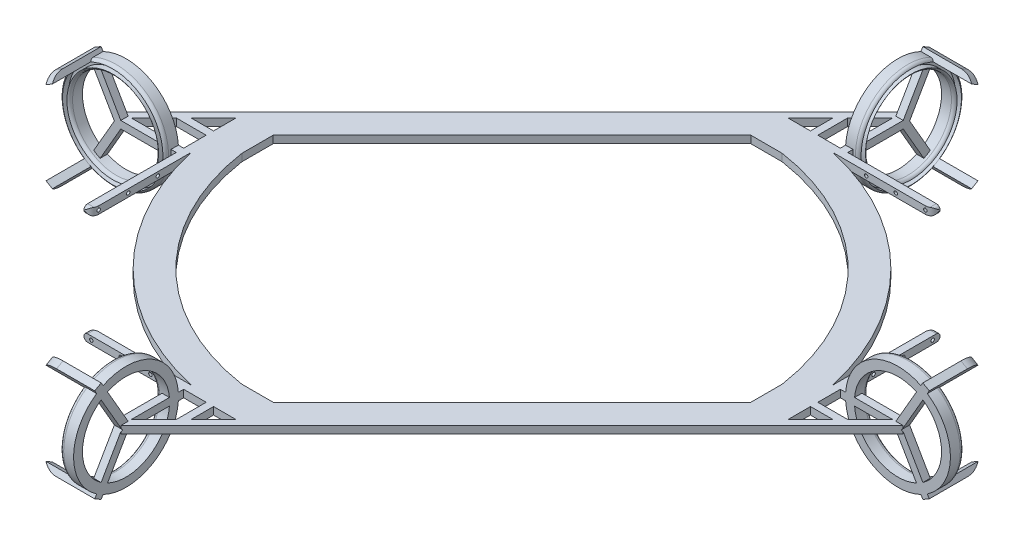
from build123d import *

# Parameters (mm, degrees)
SKETCH12_R                = 1.15
BOSS_EXTRUDE17_DEPTH      = 5
FILLET8_START             = -1
FILLET8_DEPTH             = 6
FILLET8_START_2           = -3
FILLET8_2_DEPTH           = 6
SKETCH13_W                = 12.5
SKETCH13_H                = 5
BOSS_EXTRUDE18_DEPTH      = 5
BOSS_EXTRUDE19_DEPTH      = 5
BOSS_EXTRUDE19_DEPTH_BACK = 5
SKETCH14_W                = 5
SKETCH14_H                = 5
FILLET9_R                 = 2.5
SKETCH21_R                = 35.5
SKETCH21_R_2              = 34
SKETCH21_R_3              = 31
SKETCH21_R_4              = 29.5
BOSS_EXTRUDE23_DEPTH      = 9
SKETCH22_R                = 34
SKETCH22_R_2              = 31
BOSS_EXTRUDE24_DEPTH      = 5
BOSS_EXTRUDE25_DEPTH      = 5
CIRPATTERN2_COUNT         = 3
SKETCH24_R                = 2.5
BOSS_EXTRUDE26_DEPTH      = 5
BOSS_EXTRUDE27_DEPTH      = 2.5
BOSS_EXTRUDE27_DEPTH_BACK = 2.5
CUT_EXTRUDE1_DEPTH        = 2.5
FILLET10_R                = 2.5
FILLET11_R                = 2.5
CIRPATTERN3_START         = -42.5
CIRPATTERN3_DEPTH         = 25.83484851
CIRPATTERN3_START_2       = 31.274990748
CIRPATTERN3_2_DEPTH       = 4.999999999
CIRPATTERN3_START_3       = -36.274990748
CIRPATTERN3_3_DEPTH       = 5
BOSS_EXTRUDE29_DEPTH      = 2.5
BOSS_EXTRUDE29_DEPTH_BACK = 2.5
CUT_EXTRUDE4_DEPTH        = 2.5
CUT_EXTRUDE4_DEPTH_BACK   = 2.5
BOSS_EXTRUDE32_DEPTH      = 2.5
BOSS_EXTRUDE32_DEPTH_BACK = 2.5
CHAMFER2_SIZE             = 15
CUT_EXTRUDE7_DEPTH        = 2.5
CUT_EXTRUDE7_DEPTH_BACK   = 2.5


with BuildPart() as part:
    # Sketch12 → Boss-Extrude17 (new body)
    with BuildSketch(Plane.XY):
        Polygon((-22.5, 2.5), (25, 2.5), (25, -2.5), (-22.5, -2.5), (-25, -2.5), (-25, 2.5), align=None)
        Circle(SKETCH12_R, mode=Mode.SUBTRACT)
        with Locations((-20, 0)):
            Circle(SKETCH12_R, mode=Mode.SUBTRACT)
        with Locations(Location((20, 0, 0), (0, 0, 180))):
            Circle(SKETCH12_R, mode=Mode.SUBTRACT)
    extrude(amount=BOSS_EXTRUDE17_DEPTH)

    # Fillet8: read off the stored shape, not the designer's step
    # Fillet8 outline → Fillet8 (cut)
    with BuildSketch(Plane.XY.offset(FILLET8_START)):
        with BuildLine():
            Line((25, 2.5), (22.5, 2.5))
            ThreePointArc((22.5, 2.5), (24.267766953, 1.767766953), (25, 0))
            Line((25, 0), (25, 2.5))
        make_face()
        with BuildLine():
            Line((25, -2.5), (25, 0))
            ThreePointArc((25, 0), (24.267766953, -1.767766953), (22.5, -2.5))
            Line((22.5, -2.5), (25, -2.5))
        make_face()
    extrude(amount=FILLET8_DEPTH, mode=Mode.SUBTRACT)

    # Fillet8 2 outline → Fillet8 2 (cut)
    with BuildSketch(Plane(origin=(0, 0, 0), x_dir=(1, 0, 0), z_dir=(0, 1, 0)).offset(FILLET8_START_2)):
        with BuildLine():
            Line((25, 2), (25, 0))
            ThreePointArc((25, 0), (23.535533906, -3.535533906), (20, -5))
            Line((20, -5), (27, -5))
            Line((27, -5), (27, 2))
            Line((27, 2), (25, 2))
        make_face()
    extrude(amount=FILLET8_2_DEPTH, mode=Mode.SUBTRACT)

    # Sketch13 → Boss-Extrude18 (add)
    with BuildSketch(Plane.XY):
        with Locations((-31.25, 0)):
            Rectangle(SKETCH13_W, SKETCH13_H)
    extrude(amount=BOSS_EXTRUDE18_DEPTH)

    # Sketch14 → Boss-Extrude19 (add, two sides: drawn at the far end of the back side and taken through both)
    with BuildSketch(Plane.XY.offset(-BOSS_EXTRUDE19_DEPTH_BACK)):
        with Locations((-40, 0)):
            Rectangle(SKETCH14_W, SKETCH14_H)
    extrude(amount=BOSS_EXTRUDE19_DEPTH + BOSS_EXTRUDE19_DEPTH_BACK)

    # Fillet9
    fillet9_edges = [part.edges().sort_by_distance(p)[0] for p in [
        (-42.5, 0, 5),
    ]]
    fillet(fillet9_edges, radius=FILLET9_R)

    # Sketch21 → Boss-Extrude23 (add)
    # profile 1 of 2: a face of its own
    with BuildSketch(Plane(origin=(-42.5, 0, 0), x_dir=(0, 0, -1), z_dir=(1, 0, 0))):
        with Locations(Location((39, 0, 0), (0, 0, 175.961743404))):
            Circle(SKETCH21_R)
        with Locations((39, 0)):
            Circle(SKETCH21_R_2, mode=Mode.SUBTRACT)
    # profile 2 of 2: a face of its own
    with BuildSketch(Plane(origin=(-42.5, 0, 0), x_dir=(0, 0, -1), z_dir=(1, 0, 0))):
        with Locations((39, 0)):
            Circle(SKETCH21_R_3)
        with Locations((39, 0)):
            Circle(SKETCH21_R_4, mode=Mode.SUBTRACT)
    extrude(amount=BOSS_EXTRUDE23_DEPTH)


with BuildPart() as boss_extrude23_piece_1:
    # of the separate pieces the step leaves, piece 1, a body of its own (boss_extrude23_pieces)
    add(part.part.solids().sort_by_distance((-42.5, -2.5, -3.588137581))[0])



with BuildPart() as boss_extrude23_piece_2:
    # of the separate pieces the step leaves, piece 2, a body of its own (boss_extrude23_pieces)
    add(part.part.solids().sort_by_distance((-42.5, 0, -70))[0])


with BuildPart() as boss_extrude23_piece_1_1:
    add(boss_extrude23_piece_1.part)

    add(boss_extrude23_piece_2.part)  # Boss-Extrude24 merges Boss-Extrude23 piece 2
    # Sketch22 → Boss-Extrude24 (add)
    with BuildSketch(Plane(origin=(-42.5, 0, 0), x_dir=(0, 0, -1), z_dir=(1, 0, 0))):
        with Locations((39, 0)):
            Circle(SKETCH22_R)
        with Locations((39, 0)):
            Circle(SKETCH22_R_2, mode=Mode.SUBTRACT)
    extrude(amount=BOSS_EXTRUDE24_DEPTH)

    # Sketch23 → Boss-Extrude25 (add)
    with BuildSketch(Plane(origin=(-42.5, 0, 0), x_dir=(0, 0, -1), z_dir=(1, 0, 0))):
        with BuildLine():
            Line((39, -2.5), (9.606123087, -2.5))
            ThreePointArc((9.606123087, -2.5), (9.5, 0), (9.606123087, 2.5))
            Line((9.606123087, 2.5), (39, 2.5))
            ThreePointArc((39, 2.5), (36.5, 0), (39, -2.5))
        make_face()
    boss_extrude25 = extrude(amount=BOSS_EXTRUDE25_DEPTH)

    # CirPattern2: Boss-Extrude25 ×3 about axis
    cirpattern2_axis = Axis((0, 0, -39), (1, 0, 0))
    for i in range(1, CIRPATTERN2_COUNT):
        add(boss_extrude25.rotate(cirpattern2_axis, i * 360 / CIRPATTERN2_COUNT))

    # Sketch24 → Boss-Extrude26 (add)
    with BuildSketch(Plane(origin=(-42.5, 0, 0), x_dir=(0, 0, -1), z_dir=(1, 0, 0))):
        with Locations((39, 0)):
            Circle(SKETCH24_R)
    extrude(amount=BOSS_EXTRUDE26_DEPTH)

    # Sketch25 → Boss-Extrude27 (add, two sides: drawn at the far end of the back side and taken through both)
    with BuildSketch(Plane(origin=(0, 0, 0), x_dir=(1, 0, 0), z_dir=(0, 1, 0)).offset(-BOSS_EXTRUDE27_DEPTH_BACK)):
        with BuildLine():
            Line((-85.035533974, -5), (-40, -5))
            ThreePointArc((-40, -5), (-41.767766953, -4.267766953), (-42.5, -2.5))
            Line((-42.5, -2.5), (-42.5, 0))
            Line((-42.5, 0), (-57.732233047, 0))
            Line((-57.732233047, 0), (-57.732233047, 17.732233047))
            Line((-57.732233047, 17.732233047), (-57.732233047, 20.232233047))
            Line((-57.732233047, 20.232233047), (-42.5, 35.464466094))
            Line((-42.5, 35.464466094), (-42.5, 42.535533906))
            Line((-42.5, 42.535533906), (-44.267767433, 40.767767396))
            Line((-44.267767433, 40.767767396), (-85.035533974, 0))
            Line((-85.035533974, 0), (-85.035533974, -5))
        make_face()
        Polygon((-77.964466094, 0), (-62.732233047, 15.232233047), (-62.732233047, 0), align=None, mode=Mode.SUBTRACT)
    extrude(amount=BOSS_EXTRUDE27_DEPTH + BOSS_EXTRUDE27_DEPTH_BACK)

    # Sketch26 → Cut-Extrude1 (cut)
    with BuildSketch(Plane(origin=(-42.5, 0, 0), x_dir=(0, 0, -1), z_dir=(1, 0, 0))):
        Polygon((42.535533906, 1.123724357), (41.886751346, 0), (42.535533906, -1.123724357), align=None)
    extrude(amount=-CUT_EXTRUDE1_DEPTH, mode=Mode.SUBTRACT)

    # Fillet10
    # the kernel refuses this fillet: 2.5 mm, written as the material it takes off along each edge
    with BuildSketch(Plane(origin=(-33.5, 0, -39), x_dir=(0, 0.07042253521342698, 0.9975172512463699), z_dir=(0, 0.9975172512463699, -0.07042253521342698))) as fillet10_piece_1:
        with BuildLine():
            CenterArc((33, -2.291287847), FILLET10_R, 0, 66.421821522)
            Line((34, 0), (34.02, 0.045825757))
            ThreePointArc((34.02, 0.045825757), (34.75, 0.05), (35.5, 0.05))
            Line((35.5, 0.05), (35.55, 0))
            Line((35.55, 0), (35.55, -2.291287847))
            Line((35.55, -2.291287847), (35.5, -2.291287847))
        make_face()
    revolve(axis=Axis((-33.5, 0, -39), (1, 0, 0)), mode=Mode.SUBTRACT)

    # Fillet11
    # the kernel refuses this fillet: 2.5 mm, written as the material it takes off along each edge
    with BuildSketch(Plane(origin=(-33.5, 0, -39), x_dir=(0, 0, -1), z_dir=(0, -1, 0))) as fillet11_piece_1:
        with BuildLine():
            CenterArc((32, -2.291287847), FILLET11_R, 113.578178478, 66.421821522)
            Line((29.5, -2.291287847), (29.45, -2.291287847))
            Line((29.45, -2.291287847), (29.45, 0))
            Line((29.45, 0), (29.5, 0.05))
            ThreePointArc((29.5, 0.05), (30.25, 0.05), (30.98, 0.045825757))
            Line((30.98, 0.045825757), (31, 0))
        make_face()
    revolve(axis=Axis((-33.5, 0, -39), (1, 0, 0)), mode=Mode.SUBTRACT)

    # CirPattern3: read off the stored shape, not the designer's step
    # CirPattern3 outline → CirPattern3 (add)
    with BuildSketch(Plane.YZ.offset(CIRPATTERN3_START)):
        Polygon((31.658965344, -60.165063509), (34.158965344, -55.834936491), (30.694863729, -53.834936491), (28.194863729, -58.165063509), align=None)
        Polygon((-28.194863729, -58.165063509), (-30.694863729, -53.834936491), (-34.158965344, -55.834936491), (-31.658965344, -60.165063509), align=None)
    extrude(amount=CIRPATTERN3_DEPTH)

    # CirPattern3 2 outline → CirPattern3 2 (add)
    with BuildSketch(Plane(origin=(0, 0, 0), x_dir=(1, 0, 0), z_dir=(0, 0.4999999999997474, -0.8660254037845845)).offset(CIRPATTERN3_START_2)):
        with BuildLine():
            add(Edge.make_bspline(
                [(-16.66515139, 57.5), (-11.209704134, 57.5), (-7.5, 53.5)],
                knots=[0, 0, 0, 1, 1, 1], degree=2))
            Line((-16.66515139, 57.5), (-16.66515149, 53.5))
            Line((-16.66515149, 53.5), (-7.5, 53.5))
        make_face()
    extrude(amount=CIRPATTERN3_2_DEPTH)

    # CirPattern3 3 outline → CirPattern3 3 (add)
    with BuildSketch(Plane(origin=(0, 0, 0), x_dir=(1, 0, 0), z_dir=(0, 0.5000000000000089, 0.8660254037844336)).offset(CIRPATTERN3_START_3)):
        with BuildLine():
            add(Edge.make_bspline(
                [(-16.66515139, 57.5), (-11.209704134, 57.5), (-7.5, 53.5)],
                knots=[0, 0, 0, 1, 1, 1], degree=2))
            Line((-16.66515139, 57.5), (-16.66515149, 53.5))
            Line((-16.66515149, 53.5), (-7.5, 53.5))
        make_face()
    extrude(amount=CIRPATTERN3_3_DEPTH)


with BuildPart() as body_2:
    # Mirror3: mirrored copy
    add(boss_extrude23_piece_1_1.part.mirror(Plane(origin=(49.406114601, 0, 49.406114601), x_dir=(-0.7071067811865474, 0, 0.7071067811865478), z_dir=(0.7071067811865479, 0, 0.7071067811865472))))


with BuildPart() as body_3:
    # Mirror4: mirrored copy
    add(boss_extrude23_piece_1_1.part.mirror(Plane(origin=(-132.370580695, 0, 132.370580695), x_dir=(0.7071067811865478, 0, 0.7071067811865474), z_dir=(-0.7071067811865472, 0, 0.7071067811865478))))


with BuildPart() as body_4:
    # Mirror4 2: mirrored copy
    add(body_2.part.mirror(Plane(origin=(-132.370580695, 0, 132.370580695), x_dir=(0.7071067811865478, 0, 0.7071067811865474), z_dir=(-0.7071067811865472, 0, 0.7071067811865478))))


with BuildPart() as boss_extrude23_piece_1_2:
    add(boss_extrude23_piece_1_1.part)

    add(body_2.part)  # Boss-Extrude29 merges body 2

    add(body_3.part)  # Boss-Extrude29 merges body 3

    add(body_4.part)  # Boss-Extrude29 merges body 4
    # Sketch28 → Boss-Extrude29 (add, two sides: drawn at the far end of the back side and taken through both)
    with BuildSketch(Plane(origin=(0, 0, 0), x_dir=(1, 0, 0), z_dir=(0, 1, 0)).offset(-BOSS_EXTRUDE29_DEPTH_BACK)):
        with BuildLine():
            Line((93.812229203, -181.776695297), (93.812229203, -141.312229203))
            ThreePointArc((93.812229203, -141.312229203), (45.268472374, -53.543756829), (-42.5, -5))
            Line((-42.5, -5), (-82.964466094, -5))
            Line((-82.964466094, -5), (-85.035533974, -5))
            Line((-85.035533974, -5), (-85.035533974, 0))
            Line((-85.035533974, 0), (-264.741161391, -179.705627417))
            Line((-264.741161391, -179.705627417), (-259.741161391, -179.705627417))
            Line((-259.741161391, -179.705627417), (-259.741161391, -181.776695297))
            Line((-259.741161391, -181.776695297), (-259.741161391, -222.241161391))
            ThreePointArc((-259.741161391, -222.241161391), (-211.197404562, -310.009633765), (-123.428932188, -358.553390593))
            Line((-123.428932188, -358.553390593), (-82.964466094, -358.553390593))
            Line((-82.964466094, -358.553390593), (-80.893398214, -358.553390593))
            Line((-80.893398214, -358.553390593), (-80.893398214, -363.553390593))
            Line((-80.893398214, -363.553390593), (98.812229203, -183.847763176))
            Line((98.812229203, -183.847763176), (93.812229203, -183.847763176))
            Line((93.812229203, -183.847763176), (93.812229203, -181.776695297))
        make_face()
    extrude(amount=BOSS_EXTRUDE29_DEPTH + BOSS_EXTRUDE29_DEPTH_BACK)

    # Sketch29 → Cut-Extrude4 (cut, two sides: drawn at the far end of the back side and taken through both)
    with BuildSketch(Plane(origin=(0, 0, 0), x_dir=(1, 0, 0), z_dir=(0, 1, 0)).offset(-CUT_EXTRUDE4_DEPTH_BACK)):
        Polygon((-252.670093579, -194.937860532), (-69.803300859, -12.071067812), (-55.661165235, -12.071067812), (86.741161391, -154.473394438), (86.741161391, -168.615530061), (-96.125631329, -351.482322781), (-110.267766953, -351.482322781), (-252.670093579, -209.079996156), align=None)
    extrude(amount=CUT_EXTRUDE4_DEPTH + CUT_EXTRUDE4_DEPTH_BACK, mode=Mode.SUBTRACT)

    # Sketch33 → Boss-Extrude32 (add, two sides: drawn at the far end of the back side and taken through both)
    with BuildSketch(Plane(origin=(0, 0, 0), x_dir=(1, 0, 0), z_dir=(0, 1, 0)).offset(-BOSS_EXTRUDE32_DEPTH_BACK)):
        Polygon((-69.803300859, -12.071067812), (86.741161391, -168.615530061), (86.741161391, -154.473394438), (-55.661165235, -12.071067812), align=None)
        Polygon((-252.670093579, -194.937860532), (-96.125631329, -351.482322781), (-110.267766953, -351.482322781), (-252.670093579, -209.079996156), align=None)
    extrude(amount=BOSS_EXTRUDE32_DEPTH + BOSS_EXTRUDE32_DEPTH_BACK)

    # Chamfer2
    chamfer2_edges = [boss_extrude23_piece_1_2.edges().sort_by_distance(p)[0] for p in [
        (86.741161391, 0, 168.615530061),
        (-69.803300859, 0, 12.071067812),
        (-252.670093579, 0, 194.937860532),
        (-96.125631329, 0, 351.482322781),
    ]]
    chamfer(chamfer2_edges, length=CHAMFER2_SIZE)

    # Sketch36 → Cut-Extrude7 (cut, two sides: drawn at the far end of the back side and taken through both)
    with BuildSketch(Plane(origin=(0, 0, 0), x_dir=(1, 0, 0), z_dir=(0, 1, 0)).offset(-CUT_EXTRUDE7_DEPTH_BACK)):
        with BuildLine():
            Line((-59.196699141, -22.67766953), (76.134559673, -158.008928344))
            ThreePointArc((76.134559673, -158.008928344), (30.783955315, -68.028273888), (-59.196699141, -22.67766953))
        make_face()
        with BuildLine():
            Line((-106.732233047, -340.875721064), (-242.063491861, -205.54446225))
            ThreePointArc((-242.063491861, -205.54446225), (-196.712887503, -295.525116705), (-106.732233047, -340.875721064))
        make_face()
    extrude(amount=CUT_EXTRUDE7_DEPTH + CUT_EXTRUDE7_DEPTH_BACK, mode=Mode.SUBTRACT)


solid = boss_extrude23_piece_1_2.part
